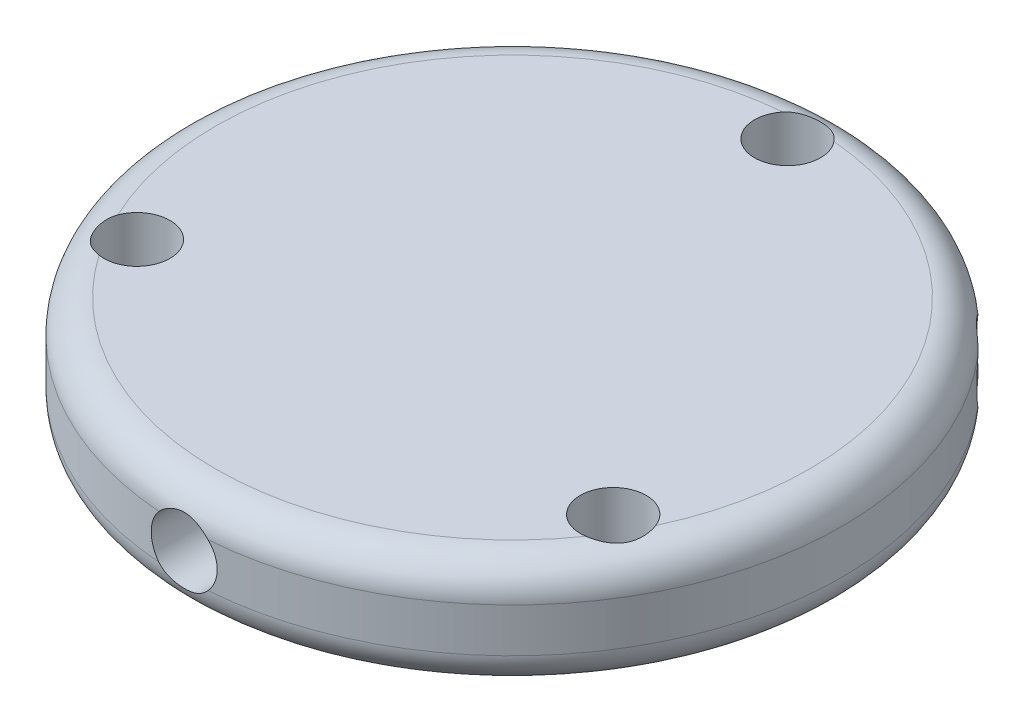
from build123d import *

# Parameters (mm, degrees)
SKETCH1_R           = 30
SKETCH1_R_2         = 3
BOSS_EXTRUDE1_DEPTH = 10
SKETCH3_R           = 3
CUT_EXTRUDE1_DEPTH  = 44.588989435
CIRPATTERN1_COUNT   = 8
FILLET1_R           = 3


with BuildPart() as part:
    # Sketch1 → Boss-Extrude1 (new body)
    with BuildSketch(Plane(origin=(0, 0, 0), x_dir=(1, 0, 0), z_dir=(0, 1, 0))):
        with Locations(Location((0, 0, 0), (0, 0, 270))):
            Circle(SKETCH1_R)
        with Locations(Location((0, 25, 0), (0, 0, 270))):
            Circle(SKETCH1_R_2, mode=Mode.SUBTRACT)
        with Locations(Location((21.650635095, -12.5, 0), (0, 0, 270))):
            Circle(SKETCH1_R_2, mode=Mode.SUBTRACT)
        with Locations(Location((-21.650635095, -12.5, 0), (0, 0, 270))):
            Circle(SKETCH1_R_2, mode=Mode.SUBTRACT)
    extrude(amount=BOSS_EXTRUDE1_DEPTH)

    # Sketch3 → Cut-Extrude1 (cut, through all)
    with BuildSketch(Plane.XY):
        with Locations(Location((0, 5, 0), (0, 0, 90))):
            Circle(SKETCH3_R)
    cut_extrude1 = extrude(amount=CUT_EXTRUDE1_DEPTH, mode=Mode.SUBTRACT)

    # CirPattern1: Cut-Extrude1 ×8 about axis, 5 skipped
    cirpattern1_axis = Axis((0, 10, 0), (0, 1, 0))
    add([cut_extrude1.rotate(cirpattern1_axis, i * 360 / CIRPATTERN1_COUNT) for i in range(1, CIRPATTERN1_COUNT) if i not in (1, 2, 4, 6, 7)], mode=Mode.SUBTRACT)

    # Fillet1
    # the kernel refuses this fillet: 3 mm, written as the material it takes off along each edge
    with BuildSketch(Plane(origin=(0, 0, 0), x_dir=(0, 0, 1), z_dir=(-1, 0, 0))) as fillet1_piece_1:
        with BuildLine():
            CenterArc((30 - FILLET1_R, FILLET1_R), FILLET1_R, 270, 90)
            Line((30 - FILLET1_R, 0), (30, 0))
            Line((30, 0), (30, FILLET1_R))
        make_face()
    revolve(axis=Axis((0, 0, 0), (0, 1, 0)), mode=Mode.SUBTRACT)
    with BuildSketch(Plane(origin=(0, 10, 0), x_dir=(0, 0, 1), z_dir=(-1, 0, 0))) as fillet1_piece_2:
        with BuildLine():
            CenterArc((30 - FILLET1_R, -FILLET1_R), FILLET1_R, 0, 90)
            Line((30 - FILLET1_R, 0), (30, 0))
            Line((30, 0), (30, -FILLET1_R))
        make_face()
    revolve(axis=Axis((0, 10, 0), (0, 1, 0)), mode=Mode.SUBTRACT)


solid = part.part
